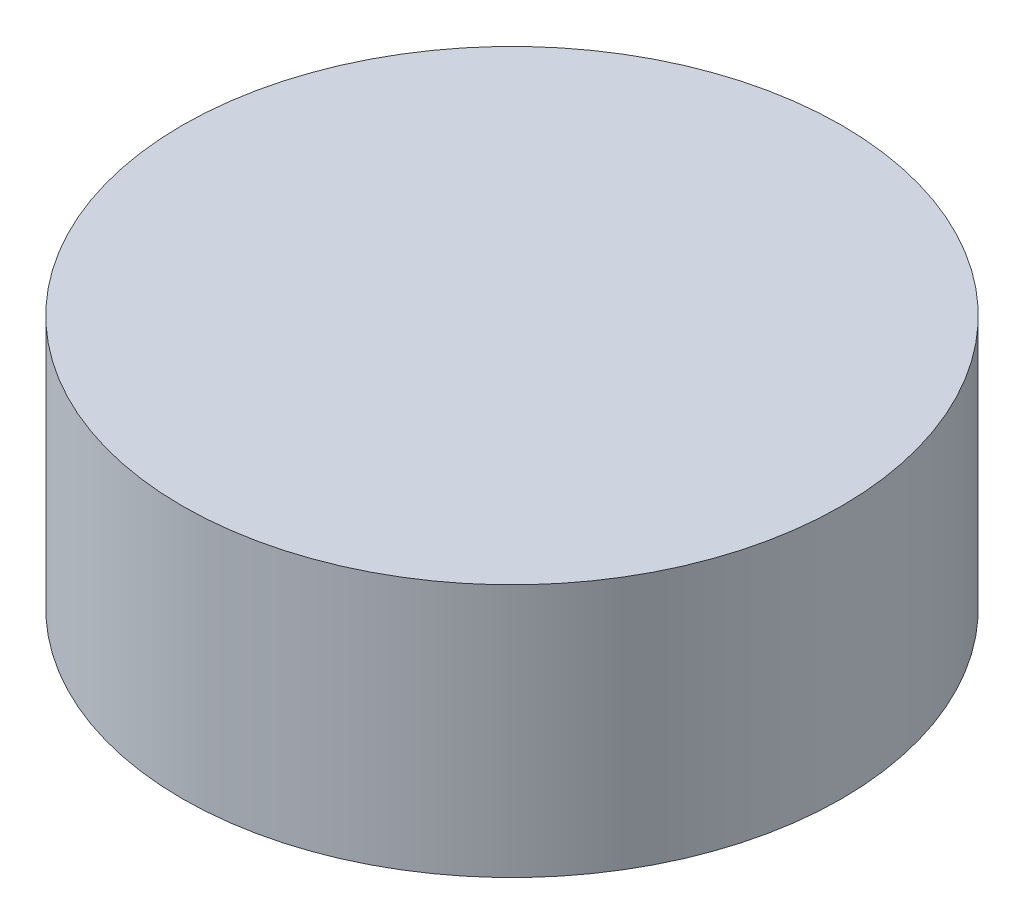
from build123d import *

# Parameters (mm, degrees)
SKETCH_1_R      = 32.25
EXTRUDE_1_DEPTH = 24.8


with BuildPart() as part:
    # 草圖1 → 填料-伸長1 (new body)
    with BuildSketch(Plane(origin=(0, 0, 0), x_dir=(1, 0, 0), z_dir=(0, 1, 0))):
        Circle(SKETCH_1_R)
    extrude(amount=EXTRUDE_1_DEPTH)


solid = part.part
